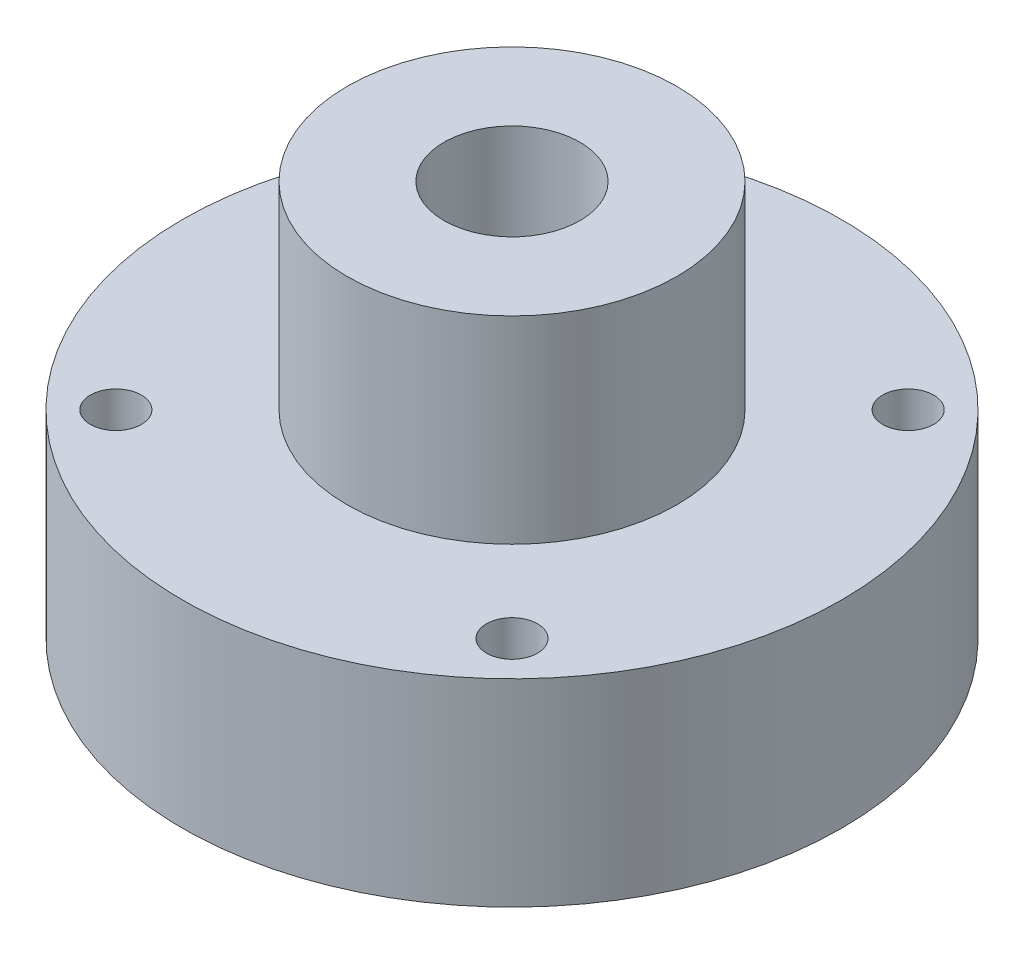
from build123d import *

# Parameters (mm, degrees)
F_10_0_1935_DIAMETER_HOLE1_D     = 4.9149
F_33_64_0_51563_DIAMETER_HOLE1_D = 13.097002


with BuildPart() as part:
    # Sketch1 → Revolve1 (revolve)
    with BuildSketch(Plane.XY):
        Polygon((-12.7, -38.1), (-3.175, -19.05), (-3.175, 0), (-15.875, 0), (-15.875, -19.05), (-31.75, -19.05), (-31.75, -38.1), (-23.8125, -38.1), (-23.8125, -34.9631), (-19.0373, -34.9631), (-19.0373, -38.1), align=None)
    revolve(axis=Axis((0, 0, 0), (0, -1, 0)))

    # #10 (0.1935) Diameter Hole1 (through all)
    with Locations(Plane(origin=(0, 0, 0), x_dir=(1, 0, 0), z_dir=(0, 1, 0))):
        with Locations((19.083044257, 19.083044257), (-19.083044257, 19.083044257), (-19.083044257, -19.083044257), (19.083044257, -19.083044257)):
            Hole(F_10_0_1935_DIAMETER_HOLE1_D / 2)

    # 33/64 (0.51563) Diameter Hole1 (through all)
    with Locations(Plane(origin=(0, 0, 0), x_dir=(1, 0, 0), z_dir=(0, 1, 0))):
        with Locations((0, 0)):
            Hole(F_33_64_0_51563_DIAMETER_HOLE1_D / 2)


solid = part.part
